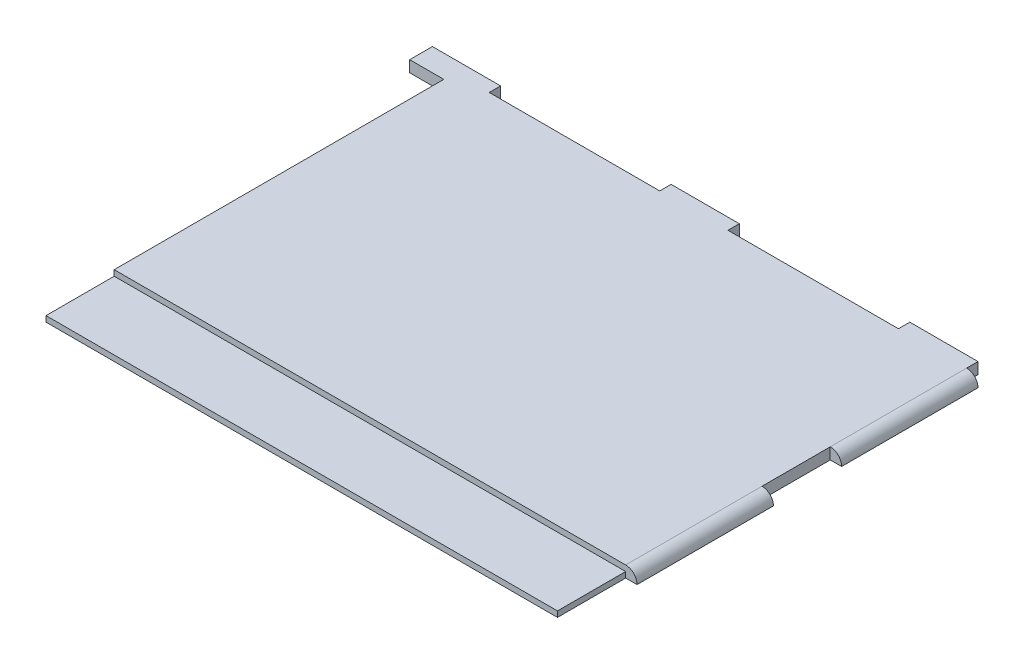
from build123d import *

# Parameters (mm, degrees)
SKETCH_1_W          = 5
SKETCH_1_H          = 60
SKETCH_1_W_2        = 30
SKETCH_1_H_2        = 5
SKETCH_1_W_3        = 15
EXTRUDE_1_DEPTH     = 5
FILLET_1_R          = 5
SKETCH_2_W          = 239.490005879
SKETCH_2_H          = 154.751616696
CUT_EXTRUDE_1_DEPTH = 355.488579047
SKETCH_3_W          = 30
SKETCH_3_H          = 2.5
CUT_EXTRUDE_2_DEPTH = 277.129805813


with BuildPart() as part:
    # 草圖1 → 填料-伸長1 (new body)
    with BuildSketch(Plane(origin=(0, 0, 0), x_dir=(1, 0, 0), z_dir=(0, 1, 0))):
        Polygon((198.746286718, -286.464902661), (198.746286718, -256.464902661), (183.246286718, -256.464902661), (183.246286718, -266.464902661), (124.746286718, -266.464902661), (124.746286718, -262.464902661), (109.246286718, -262.464902661), (109.246286718, -266.464902661), (-21.253713282, -266.464902661), (-21.253713282, 38.535097339), (-36.253713282, 38.535097339), (-36.253713282, 43.535097339), (203.746286718, 43.535097339), (203.746286718, -286.464902661), align=None)
        with Locations((206.246286718, -256.464902661)):
            Rectangle(SKETCH_1_W, SKETCH_1_H)
        with Locations((206.246286718, 13.535097339)):
            Rectangle(SKETCH_1_W, SKETCH_1_H)
        with Locations((188.746286718, 46.035097339)):
            Rectangle(SKETCH_1_W_2, SKETCH_1_H_2)
        with Locations((-21.253713282, 46.035097339)):
            Rectangle(SKETCH_1_W_2, SKETCH_1_H_2)
        with Locations((91.246286718, 46.035097339)):
            Rectangle(SKETCH_1_W_3, SKETCH_1_H_2)
        with Locations((76.246286718, 46.035097339)):
            Rectangle(SKETCH_1_W_3, SKETCH_1_H_2)
        with Locations((206.246286718, -166.464902661)):
            Rectangle(SKETCH_1_W, SKETCH_1_H)
        with Locations((206.246286718, -76.464902661)):
            Rectangle(SKETCH_1_W, SKETCH_1_H)
    extrude(amount=EXTRUDE_1_DEPTH)

    # 圓角1
    fillet_1_edges = [part.edges().sort_by_distance(p)[0] for p in [
        (208.746286718, 5, -13.535097339),
        (208.746286718, 5, 76.464902661),
        (208.746286718, 5, 166.464902661),
        (208.746286718, 5, 256.464902661),
    ]]
    fillet(fillet_1_edges, radius=FILLET_1_R - 0.0001)  # a hair under: the kernel refuses the full size

    # 草圖2 → 除料-伸長1 (cut, through all)
    with BuildSketch(Plane(origin=(0, 5, 0), x_dir=(1, 0, 0), z_dir=(0, 1, 0))):
        with Locations((89.001283779, -213.840711009)):
            Rectangle(SKETCH_2_W, SKETCH_2_H)
    extrude(amount=-CUT_EXTRUDE_1_DEPTH, mode=Mode.SUBTRACT)

    # 草圖3 → 除料-伸長2 (cut, through all)
    with BuildSketch(Plane(origin=(203.746286718, 0, 0), x_dir=(0, 0, -1), z_dir=(1, 0, 0))):
        with Locations((-121.464902661, 3.75)):
            Rectangle(SKETCH_3_W, SKETCH_3_H)
    extrude(amount=-CUT_EXTRUDE_2_DEPTH, mode=Mode.SUBTRACT)


solid = part.part
